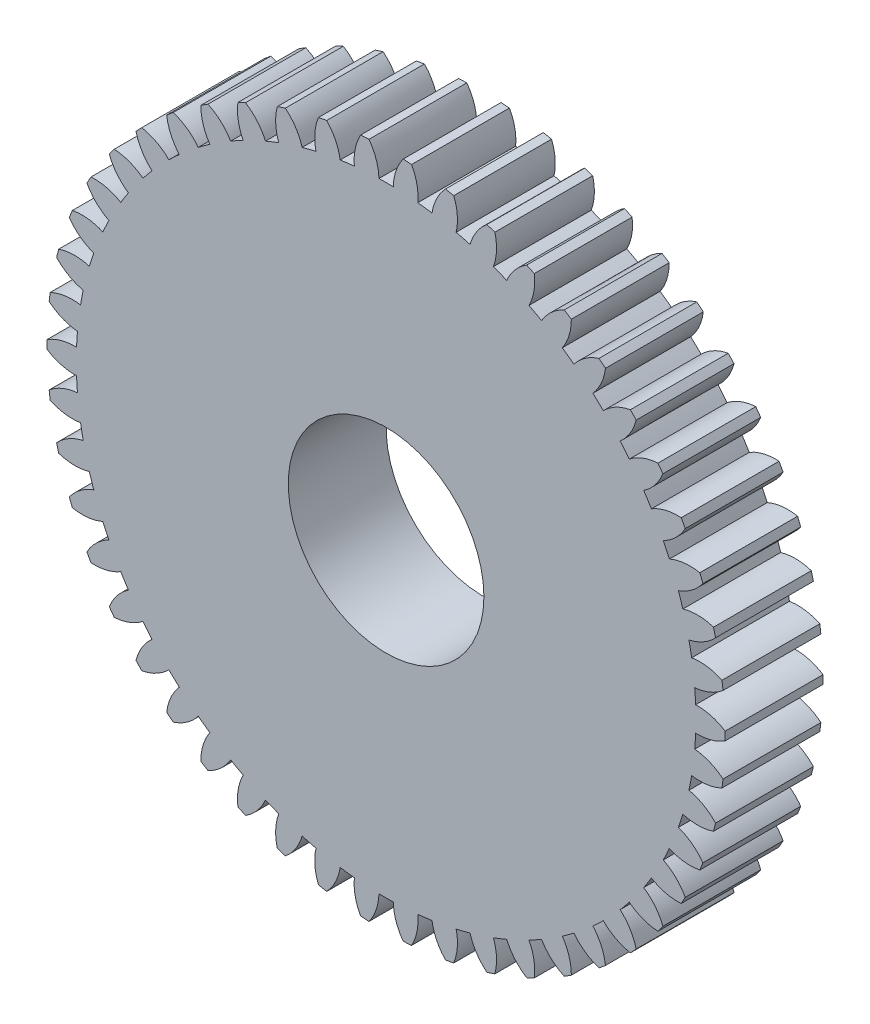
from build123d import *

# Parameters (mm, degrees)
SKETCH1_R           = 52
BOSS_EXTRUDE3_DEPTH = 7.5
CIRPATTERN1_COUNT   = 50
SKETCH7_R           = 15
CUT_EXTRUDE1_DEPTH  = 76.007567823


with BuildPart() as part:
    # Sketch1 → Boss-Extrude3 (new, symmetric)
    with BuildSketch(Plane.XY):
        Circle(SKETCH1_R)
    extrude(amount=BOSS_EXTRUDE3_DEPTH, both=True)

    # Sketch5 → Cut-Loft1 section 0
    with BuildSketch(Plane.XY.offset(7.5)):
        with BuildLine():
            ThreePointArc((-3.449512603, 52.887624855), (-1.746852768, 50.417329049), (-1.101992271, 47.487215259))
            ThreePointArc((-1.101992271, 47.487215259), (0, 47.5), (1.101992271, 47.487215259))
            ThreePointArc((1.101992271, 47.487215259), (1.746852768, 50.417329049), (3.449512603, 52.887624855))
            ThreePointArc((3.449512603, 52.887624855), (0, 53), (-3.449512603, 52.887624855))
        make_face()
    # Sketch3 → Cut-Loft1 section 1
    with BuildSketch(Plane.XY):
        with BuildLine():
            ThreePointArc((-3.449512603, 52.887624855), (-1.746852768, 50.417329049), (-1.101992271, 47.487215259))
            ThreePointArc((-1.101992271, 47.487215259), (0, 47.5), (1.101992271, 47.487215259))
            ThreePointArc((1.101992271, 47.487215259), (1.746852768, 50.417329049), (3.449512603, 52.887624855))
            ThreePointArc((3.449512603, 52.887624855), (0, 53), (-3.449512603, 52.887624855))
        make_face()
    # Sketch6 → Cut-Loft1 section 2
    with BuildSketch(Plane.XY.offset(-7.5)):
        with BuildLine():
            ThreePointArc((-3.449512603, 52.887624855), (-1.746852768, 50.417329049), (-1.101992271, 47.487215259))
            ThreePointArc((-1.101992271, 47.487215259), (0, 47.5), (1.101992271, 47.487215259))
            ThreePointArc((1.101992271, 47.487215259), (1.746852768, 50.417329049), (3.449512603, 52.887624855))
            ThreePointArc((3.449512603, 52.887624855), (0, 53), (-3.449512603, 52.887624855))
        make_face()
    cut_loft1 = loft(mode=Mode.SUBTRACT)

    # CirPattern1: Cut-Loft1 ×50 about axis
    cirpattern1_axis = Axis((0, 0, 7.5), (0, 0, -1))
    for i in range(1, CIRPATTERN1_COUNT):
        add(cut_loft1.rotate(cirpattern1_axis, i * 360 / CIRPATTERN1_COUNT), mode=Mode.SUBTRACT)

    # Sketch7 → Cut-Extrude1 (cut, through all)
    with BuildSketch(Plane.XY.offset(7.5)):
        Circle(SKETCH7_R)
    extrude(amount=-CUT_EXTRUDE1_DEPTH, mode=Mode.SUBTRACT)


solid = part.part
